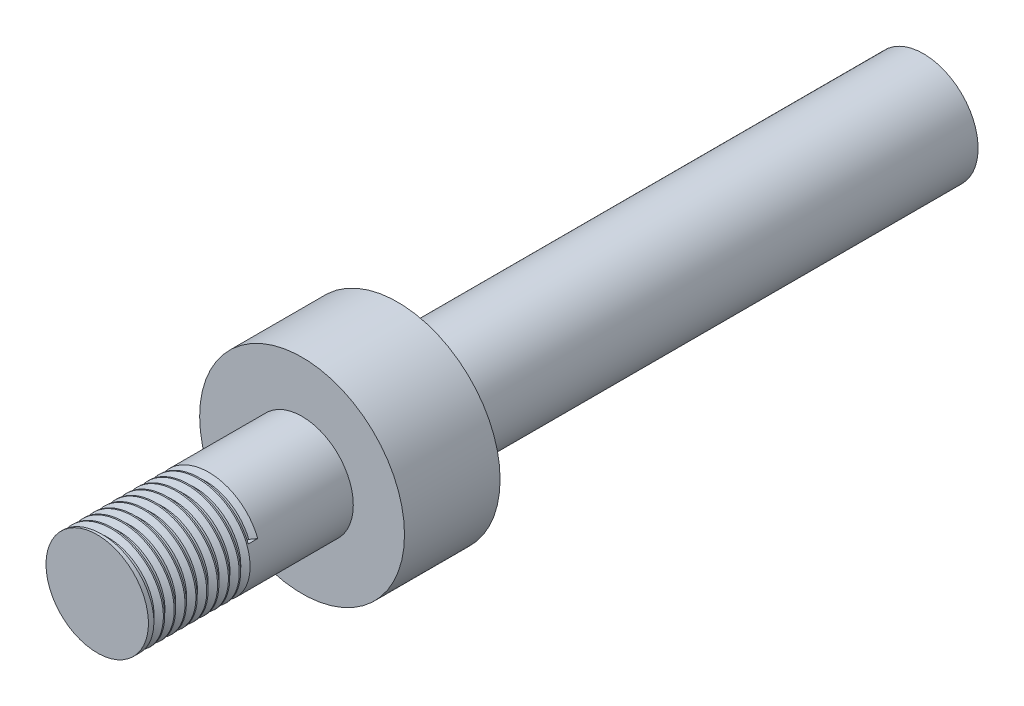
from build123d import *

# Parameters (mm, degrees)
SKETCH1_R           = 1.6
BOSS_EXTRUDE1_DEPTH = 15.4
SKETCH4_R           = 3
BOSS_EXTRUDE2_DEPTH = 2.8
SKETCH5_R           = 1.5
BOSS_EXTRUDE3_DEPTH = 6
THREAD2_PITCH       = 0.3175


with BuildPart() as part:
    # Sketch1 → Boss-Extrude1 (new body)
    with BuildSketch(Plane.XY):
        with Locations(Location((0, 0, 0), (0, 0, 180))):
            Circle(SKETCH1_R)
    extrude(amount=BOSS_EXTRUDE1_DEPTH)

    # Sketch4 → Boss-Extrude2 (add)
    with BuildSketch(Plane.XY.offset(15.4)):
        Circle(SKETCH4_R)
    extrude(amount=BOSS_EXTRUDE2_DEPTH)

    # Sketch5 → Boss-Extrude3 (add)
    with BuildSketch(Plane.XY.offset(18.2)):
        Circle(SKETCH5_R)
    extrude(amount=BOSS_EXTRUDE3_DEPTH)

    # Thread2: the profile of Thread Profile2 profile screwed along a right-hand helix of 9.448819 turns, 6 arcs to a turn; built about Z, then put on its axis
    thread2_z = Axis((0, 0, 0), (0, 0, 1))
    thread2_corners = [(1.5003, 0, -0.000173205), (1.5003, 0, 0.277985704), (1.328148085, 0, 0.17859375), (1.328148085, 0, 0.09921875)]
    with BuildLine(mode=Mode.PRIVATE) as thread2_profile:
        Line(thread2_corners[0], thread2_corners[1])
        Line(thread2_corners[1], thread2_corners[2])
        Line(thread2_corners[2], thread2_corners[3])
        Line(thread2_corners[3], thread2_corners[0])
    thread2_cap = Face(thread2_profile.wire())
    thread2_turn_angles = [0, 30, 60, 90, 120, 150, 180, 210, 240, 270, 300, 330, 360]
    thread2_turn_weights = [1, 0.8660254037844387, 1, 0.8660254037844387, 1, 0.8660254037844387, 1, 0.8660254037844387, 1, 0.8660254037844387, 1, 0.8660254037844387, 1]
    thread2_turn_rails = [Edge.make_bspline([Vector(p[0], p[1], 0).rotate(thread2_z, thread2_turn_angles[k]) / thread2_turn_weights[k] + Vector(0, 0, p[2] + THREAD2_PITCH * thread2_turn_angles[k] / 360) for k in range(13)], [0, 0, 0, 1, 1, 2, 2, 3, 3, 4, 4, 5, 5, 6, 6, 6], 2, thread2_turn_weights) for p in thread2_corners]
    thread2_turn_sides = [Face.make_surface_from_curves(thread2_turn_rails[p[0]], thread2_turn_rails[p[1]]) for p in [(0, 1), (1, 2), (2, 3), (3, 0)]]
    thread2_last_angles = [3240, 3270, 3300, 3330, 3360, 3380.787401575, 3401.57480315]
    thread2_last_weights = [1, 0.8660254037844387, 1, 0.8660254037844387, 1, 0.9349037361358654, 1]
    thread2_last_rails = [Edge.make_bspline([Vector(p[0], p[1], 0).rotate(thread2_z, thread2_last_angles[k]) / thread2_last_weights[k] + Vector(0, 0, p[2] + THREAD2_PITCH * thread2_last_angles[k] / 360) for k in range(7)], [0, 0, 0, 1, 1, 2, 2, 3, 3, 3], 2, thread2_last_weights) for p in thread2_corners]
    thread2_last_sides = [Face.make_surface_from_curves(thread2_last_rails[p[0]], thread2_last_rails[p[1]]) for p in [(0, 1), (1, 2), (2, 3), (3, 0)]]
    thread2 = Plane(origin=(0, 0, 24.2), x_dir=(-1, 0, 0), z_dir=(0, 0, -1)) * Solid(Shell([*[p.moved(Location((0, 0, THREAD2_PITCH * i))) for i in range(9) for p in thread2_turn_sides], *thread2_last_sides, thread2_cap, thread2_cap.rotate(thread2_z, 3401.57480315).moved(Location((0, 0, THREAD2_PITCH * 3401.57480315 / 360)))]))
    add(thread2, mode=Mode.SUBTRACT)


solid = part.part
